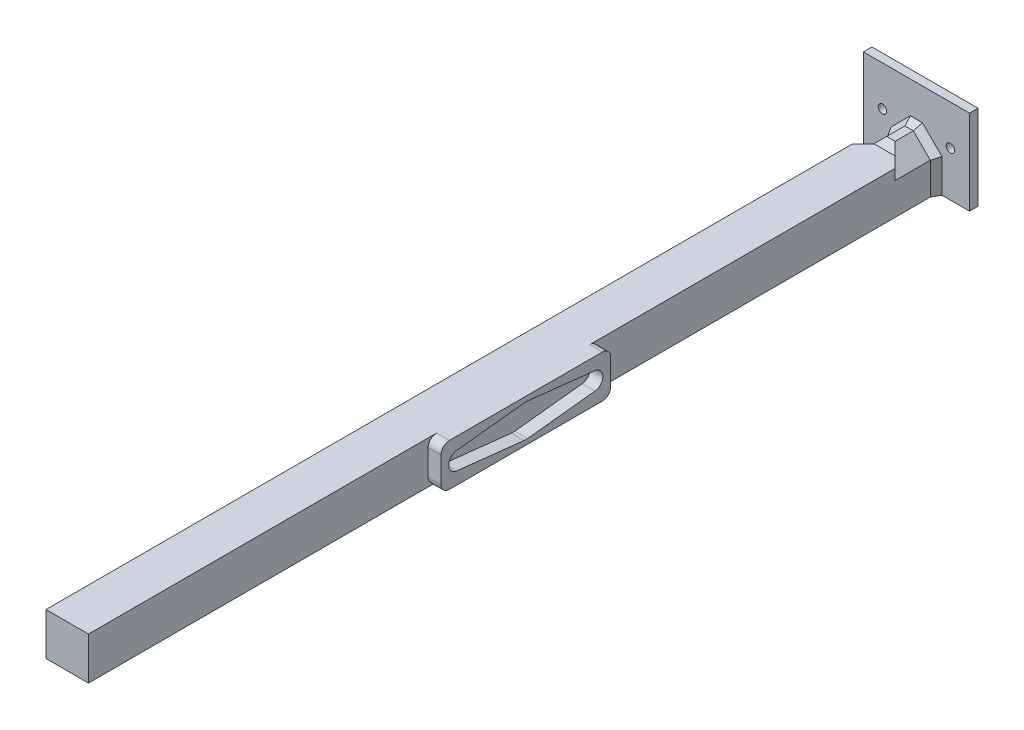
from build123d import *
from build123d.topology import SkipClean

# Parameters (mm, degrees)
SKETCH1_W           = 10
SKETCH1_H           = 10
BOSS_EXTRUDE1_DEPTH = 100
SKETCH2_W           = 25
SKETCH2_H           = 20
SKETCH2_R           = 1
BOSS_EXTRUDE2_DEPTH = 2
CUT_EXTRUDE2_DEPTH  = 2.5
CHAMFER2_SIZE       = 2.5
BOSS_EXTRUDE3_DEPTH = 7.5
CUT_EXTRUDE3_DEPTH  = 7.5
SKETCH8_W           = 40
SKETCH8_H           = 10
BOSS_EXTRUDE4_DEPTH = 3
FILLET1_R           = 2
SKETCH9_R           = 3
CUT_EXTRUDE4_DEPTH  = 5


with BuildPart() as part:
    # Sketch1 → Boss-Extrude1 (new, symmetric)
    with BuildSketch(Plane.XY):
        Rectangle(SKETCH1_W, SKETCH1_H)
    extrude(amount=BOSS_EXTRUDE1_DEPTH, both=True)

    # Sketch2 → Boss-Extrude2 (add)
    with BuildSketch(Plane(origin=(0, 0, -100), x_dir=(-1, 0, 0), z_dir=(0, 0, -1))):
        with Locations((0, 5)):
            Rectangle(SKETCH2_W, SKETCH2_H)
        with Locations((-8, 5.6)):
            Circle(SKETCH2_R, mode=Mode.SUBTRACT)
        with Locations(Location((8, 5.6, 0), (0, 0, 180))):
            Circle(SKETCH2_R, mode=Mode.SUBTRACT)
    extrude(amount=BOSS_EXTRUDE2_DEPTH)

    # Sketch4 → Cut-Extrude2 (cut)
    with BuildSketch(Plane(origin=(0, 5, 0), x_dir=(1, 0, 0), z_dir=(0, 1, 0))):
        Polygon((5, 100), (2.5, 100), (2.5, 92.5), (5, 90), (5, 92.5), align=None)
        Polygon((-5, 90), (-5, 92.5), (-5, 100), (-2.5, 100), (-2.5, 92.5), align=None)
    extrude(amount=-CUT_EXTRUDE2_DEPTH, mode=Mode.SUBTRACT)

    # Chamfer2
    chamfer2_edges = [part.edges().sort_by_distance(p)[0] for p in [
        (-2.5, 2.5, -96.25),
        (2.5, 2.5, -96.25),
    ]]
    chamfer(chamfer2_edges, length=CHAMFER2_SIZE - 0.0001)  # a hair under: the kernel refuses the full size

    # Sketch5 → Boss-Extrude3 (add)
    with SkipClean():  # the faces are left unmerged after this step: merging them gives an invalid solid
        with BuildSketch(Plane.XY.offset(-100)):
            Polygon((-2.5, 5), (-1, 6.5), (1, 6.5), (2.5, 5), align=None)
        extrude(amount=BOSS_EXTRUDE3_DEPTH)

    # Sketch7 → Cut-Extrude3 (cut)
    with SkipClean():  # the faces are left unmerged after this step: merging them gives an invalid solid
        with BuildSketch(Plane(origin=(5, 0, 0), x_dir=(0, 0, -1), z_dir=(1, 0, 0))):
            Polygon((92.5, 5), (94, 6.5), (92.5, 6.5), align=None)
        extrude(amount=-CUT_EXTRUDE3_DEPTH, mode=Mode.SUBTRACT)

    # Chamfer3: read off the stored shape, not the designer's step
    # Chamfer3: loft between two sections, ruled curve by curve
    with SkipClean():  # the faces are left unmerged after this step: merging them gives an invalid solid
        chamfer3_from = [
            Edge.make_line((-5, -5, -98.267949192), (-5, 2.5, -98.267949192)),
            Edge.make_line((-5, 2.5, -98.267949192), (-1, 6.5, -98.267949192)),
            Edge.make_line((-1, 6.5, -98.267949192), (1, 6.5, -98.267949192)),
            Edge.make_line((1, 6.5, -98.267949192), (5, 2.5, -98.267949192)),
            Edge.make_line((5, -5, -98.267949192), (5, 2.5, -98.267949192)),
            Edge.make_line((5, -5, -98.267949192), (-5, -5, -98.267949192)),
        ]
        chamfer3_to = [
            Edge.make_line((-6, -5, -100), (-6, 2.914213562, -100)),
            Edge.make_line((-6, 2.914213562, -100), (-1.414213562, 7.5, -100)),
            Edge.make_line((-1.414213562, 7.5, -100), (1.414213562, 7.5, -100)),
            Edge.make_line((1.414213562, 7.5, -100), (6, 2.914213562, -100)),
            Edge.make_line((6, -5, -100), (6, 2.914213562, -100)),
            Edge.make_line((6, -5, -100), (-6, -5, -100)),
        ]
        chamfer3 = Solid(Shell([*[Face.make_surface_from_curves(chamfer3_from[k], chamfer3_to[k]) for k in range(6)], Face(Wire(chamfer3_from)), Face(Wire(chamfer3_to))]))
        add(chamfer3)

    # Sketch8 → Boss-Extrude4 (add)
    with SkipClean():  # the faces are left unmerged after this step: merging them gives an invalid solid
        with BuildSketch(Plane(origin=(5, 0, 0), x_dir=(0, 0, -1), z_dir=(1, 0, 0))):
            Rectangle(SKETCH8_W, SKETCH8_H)
            with BuildLine():
                Line((0.419781931, 3.827046267), (16.278971963, 2.087479782))
                ThreePointArc((16.278971963, 2.087479782), (18.15, 0), (16.278971963, -2.087479782))
                Line((16.278971963, -2.087479782), (0.419781931, -3.827046267))
                ThreePointArc((0.419781931, -3.827046267), (0, -3.85), (-0.419781931, -3.827046267))
                Line((-0.419781931, -3.827046267), (-16.278971963, -2.087479782))
                ThreePointArc((-16.278971963, -2.087479782), (-18.15, 0), (-16.278971963, 2.087479782))
                Line((-16.278971963, 2.087479782), (-0.419781931, 3.827046267))
                ThreePointArc((-0.419781931, 3.827046267), (0, 3.85), (0.419781931, 3.827046267))
            make_face(mode=Mode.SUBTRACT)
        extrude(amount=BOSS_EXTRUDE4_DEPTH)

    # Fillet1
    # the kernel refuses this fillet: 2 mm, written as the material it takes off along each edge
    with BuildSketch(Plane(origin=(5, 5, -20), x_dir=(0, -1, 0), z_dir=(1, 0, 0)), Plane(origin=(5, -5, -20), x_dir=(0, 0, 1), z_dir=(1, 0, 0))) as fillet1_piece_1:
        with BuildLine():
            CenterArc((FILLET1_R, -FILLET1_R), FILLET1_R, 90, 90)
            Line((0, -FILLET1_R), (0, 0))
            Line((0, 0), (FILLET1_R, 0))
        make_face()
    extrude(amount=8, mode=Mode.SUBTRACT)
    with BuildSketch(Plane(origin=(5, 5, 20), x_dir=(0, -1, 0), z_dir=(1, 0, 0)), Plane(origin=(5, -5, 20), x_dir=(0, 0, -1), z_dir=(1, 0, 0))) as fillet1_piece_2:
        with BuildLine():
            CenterArc((FILLET1_R, FILLET1_R), FILLET1_R, 180, 90)
            Line((0, FILLET1_R), (0, 0))
            Line((0, 0), (FILLET1_R, 0))
        make_face()
    extrude(amount=8, mode=Mode.SUBTRACT)

    # Sketch9 → Cut-Extrude4 (cut)
    with SkipClean():  # the faces are left unmerged after this step: merging them gives an invalid solid
        with BuildSketch(Plane.ZY.offset(5)):
            Circle(SKETCH9_R)
        extrude(amount=-CUT_EXTRUDE4_DEPTH, mode=Mode.SUBTRACT)


solid = part.part
